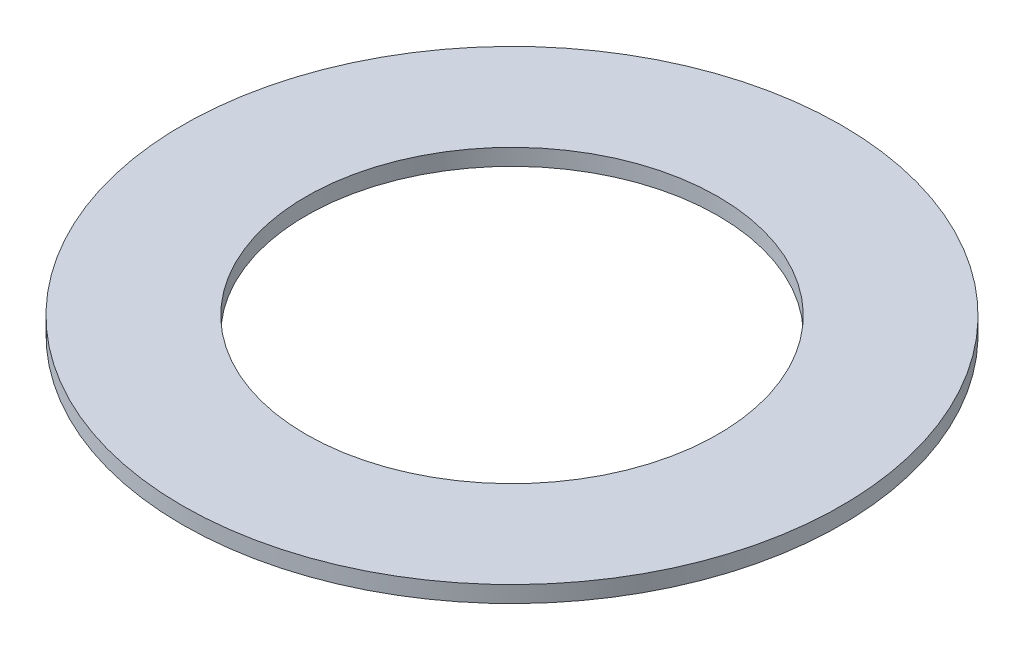
from build123d import *

# Parameters (mm, degrees)
SKETCH2_R           = 20
SKETCH2_R_2         = 12.5
BOSS_EXTRUDE1_DEPTH = 1


with BuildPart() as part:
    # Sketch2 → Boss-Extrude1 (new body)
    with BuildSketch(Plane(origin=(0, 0, 0), x_dir=(1, 0, 0), z_dir=(0, 1, 0))):
        Circle(SKETCH2_R)
        Circle(SKETCH2_R_2, mode=Mode.SUBTRACT)
    extrude(amount=BOSS_EXTRUDE1_DEPTH)


solid = part.part
